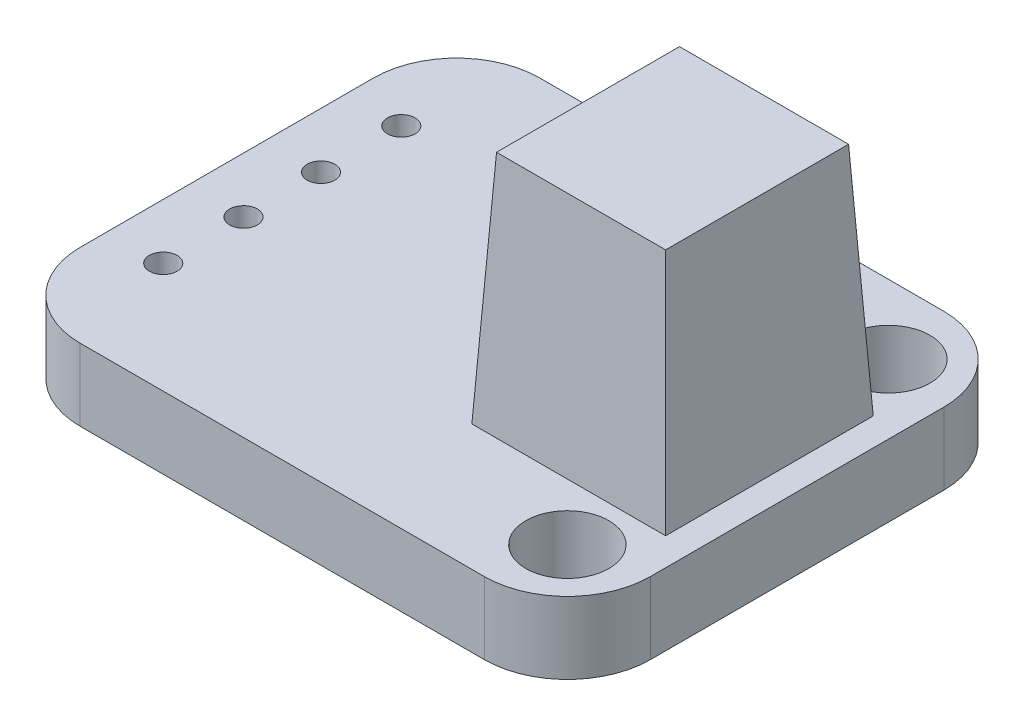
from build123d import *

# Parameters (mm, degrees)
SKETCH1_W           = 20.6
SKETCH1_H           = 16.6
BOSS_EXTRUDE1_DEPTH = 2.6
FILLET1_R           = 3
SKETCH2_R           = 1.5
CUT_EXTRUDE1_DEPTH  = 2.6
SKETCH3_W           = 7
SKETCH3_H           = 7.5
BOSS_EXTRUDE2_DEPTH = 8.5
BOSS_EXTRUDE2_TAPER = 3
SKETCH4_R           = 0.5
CUT_EXTRUDE2_DEPTH  = 8.5


with BuildPart() as part:
    # Sketch1 → Boss-Extrude1 (new body)
    with BuildSketch(Plane(origin=(0, 0, 0), x_dir=(1, 0, 0), z_dir=(0, 1, 0))):
        Rectangle(SKETCH1_W, SKETCH1_H)
    extrude(amount=BOSS_EXTRUDE1_DEPTH)

    # Fillet1
    fillet1_edges = [part.edges().sort_by_distance(p)[0] for p in [
        (-10.3, 1.3, -8.3),
        (-10.3, 1.3, 8.3),
        (10.3, 1.3, -8.3),
        (10.3, 1.3, 8.3),
    ]]
    fillet(fillet1_edges, radius=FILLET1_R)

    # Sketch2 → Cut-Extrude1 (cut)
    with BuildSketch(Plane(origin=(0, 2.6, 0), x_dir=(1, 0, 0), z_dir=(0, 1, 0))):
        with Locations((7.8, 5.8)):
            Circle(SKETCH2_R)
        with Locations((7.8, -5.8)):
            Circle(SKETCH2_R)
    extrude(amount=-CUT_EXTRUDE1_DEPTH, mode=Mode.SUBTRACT)

    # Sketch3 → Boss-Extrude2 (add)
    with BuildSketch(Plane(origin=(0, 2.6, 0), x_dir=(1, 0, 0), z_dir=(0, 1, 0))):
        with Locations((5.8, 0)):
            Rectangle(SKETCH3_W, SKETCH3_H)
    extrude(amount=BOSS_EXTRUDE2_DEPTH, taper=BOSS_EXTRUDE2_TAPER)

    # Sketch4 → Cut-Extrude2 (cut)
    with BuildSketch(Plane(origin=(0, 2.6, 0), x_dir=(1, 0, 0), z_dir=(0, 1, 0))):
        with Locations((-8.3, 4.3)):
            Circle(SKETCH4_R)
        with Locations((-8.3, -4.3)):
            Circle(SKETCH4_R)
        with Locations((-8.3, -1.4)):
            Circle(SKETCH4_R)
        with Locations((-8.3, 1.4)):
            Circle(SKETCH4_R)
    extrude(amount=-CUT_EXTRUDE2_DEPTH, mode=Mode.SUBTRACT)


solid = part.part
